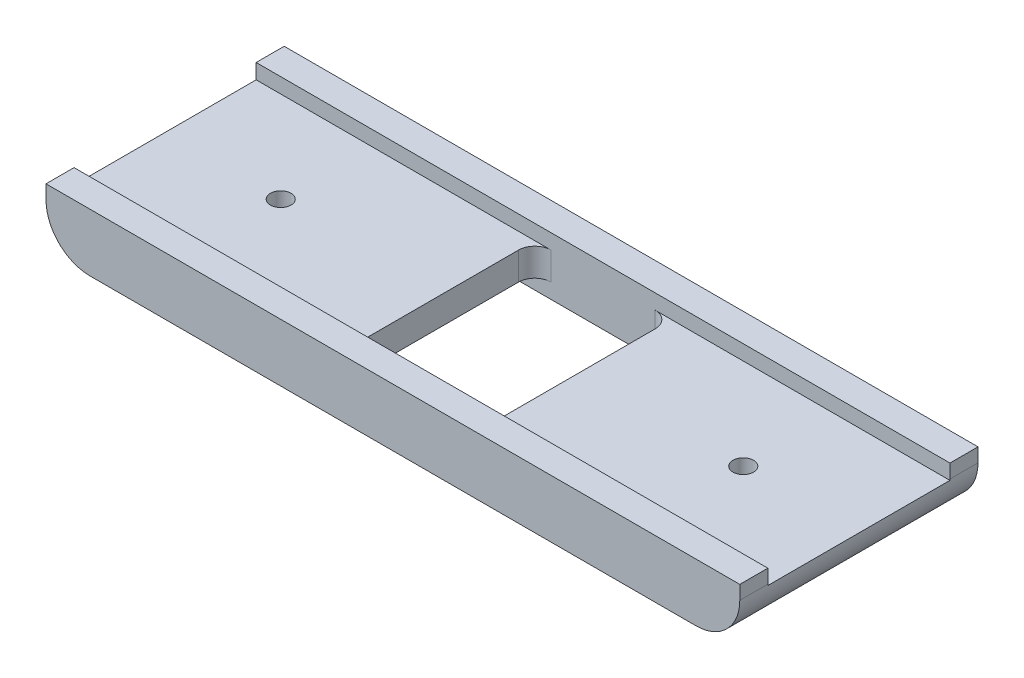
from build123d import *

# Parameters (mm, degrees)
SKETCH1_W               = 76.2
SKETCH1_H               = 26.162
BOSS_EXTRUDE1_DEPTH     = 6.35
FILLET1_R               = 4.826
SKETCH2_W               = 20
SKETCH2_H               = 1.651
CUT_EXTRUDE1_DEPTH      = 78.574964138
CUT_EXTRUDE2_DEPTH      = 41.556172921
CUT_EXTRUDE2_DEPTH_BACK = 41.556172921
F_4_40_TAPPED_HOLE1_D   = 2.2606
SKETCH8_W               = 20
SKETCH8_H               = 1.651
CUT_EXTRUDE3_DEPTH      = 78.574964138


with BuildPart() as part:
    # Sketch1 → Boss-Extrude1 (new body)
    with BuildSketch(Plane(origin=(0, 0, 0), x_dir=(1, 0, 0), z_dir=(0, 1, 0))):
        Rectangle(SKETCH1_W, SKETCH1_H)
    extrude(amount=BOSS_EXTRUDE1_DEPTH)

    # Fillet1
    fillet1_edges = [part.edges().sort_by_distance(p)[0] for p in [
        (38.1, 0, 0),
        (-38.1, 0, 0),
    ]]
    fillet(fillet1_edges, radius=FILLET1_R)

    # Sketch2 → Cut-Extrude1 (cut, through all)
    with BuildSketch(Plane(origin=(38.1, 0, 0), x_dir=(0, 0, -1), z_dir=(1, 0, 0))):
        with Locations((0, 0.8255)):
            Rectangle(SKETCH2_W, SKETCH2_H)
    extrude(amount=-CUT_EXTRUDE1_DEPTH, mode=Mode.SUBTRACT)

    # Sketch3 → Cut-Extrude2 (cut, two sides: drawn at the far end of the back side and taken through both)
    with BuildSketch(Plane.XZ.offset(-1.651).offset(-CUT_EXTRUDE2_DEPTH_BACK)):
        with BuildLine():
            Line((5.722, -10), (-5.722, -10))
            ThreePointArc((-5.722, -10), (-6.979235857, -9.479235857), (-7.5, -8.222))
            Line((-7.5, -8.222), (-7.5, 8.222))
            ThreePointArc((-7.5, 8.222), (-6.979235857, 9.479235857), (-5.722, 10))
            Line((-5.722, 10), (5.722, 10))
            ThreePointArc((5.722, 10), (6.979235857, 9.479235857), (7.5, 8.222))
            Line((7.5, 8.222), (7.5, -8.222))
            ThreePointArc((7.5, -8.222), (6.979235857, -9.479235857), (5.722, -10))
        make_face()
    extrude(amount=CUT_EXTRUDE2_DEPTH + CUT_EXTRUDE2_DEPTH_BACK, mode=Mode.SUBTRACT)

    # #4-40 Tapped Hole1 (through all)
    with Locations(Plane(origin=(0, 6.35, 0), x_dir=(-1, 0, 0), z_dir=(0, 1, 0))):
        with Locations((25.4, 0), (-25.4, 0)):
            Hole(F_4_40_TAPPED_HOLE1_D / 2)

    # Sketch8 → Cut-Extrude3 (cut, through all)
    with BuildSketch(Plane(origin=(38.1, 0, 0), x_dir=(0, 0, -1), z_dir=(1, 0, 0))):
        with Locations((0, 5.5245)):
            Rectangle(SKETCH8_W, SKETCH8_H)
    extrude(amount=-CUT_EXTRUDE3_DEPTH, mode=Mode.SUBTRACT)


solid = part.part
